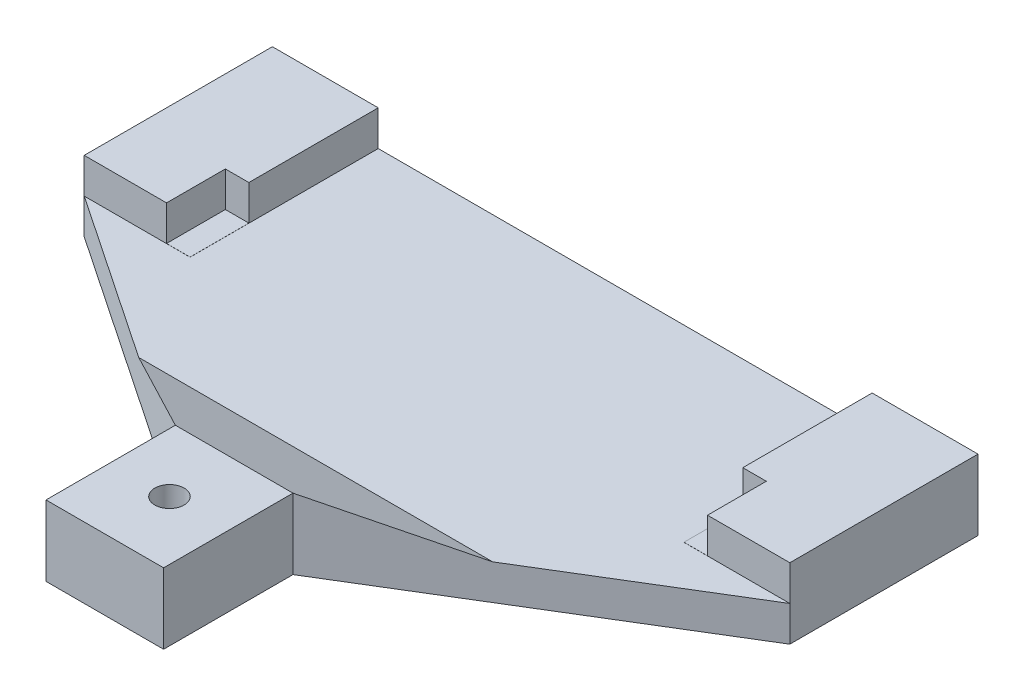
from build123d import *

# Parameters (mm, degrees)
ESQUISSE1_W              = 60
ESQUISSE1_H              = 6
BOSS_EXTRU_1_DEPTH       = 60
ESQUISSE2_R              = 1.25
ENL_V_MAT_EXTRU_1_DEPTH  = 10
ESQUISSE3_R              = 1.25
ENL_V_MAT_EXTRU_2_DEPTH  = 15
ESQUISSE4_W              = 10
ESQUISSE4_H              = 11
ENL_V_MAT_EXTRU_3_DEPTH  = 3
ENL_V_MAT_EXTRU_4_DEPTH  = 52
CHANFREIN1_SIZE2         = 6.433520762
CHANFREIN1_SIZE          = 3
ESQUISSE6_W              = 2
ESQUISSE6_H              = 5
ENL_V_MAT_EXTRU_16_DEPTH = 2.99


with BuildPart() as part:
    # Esquisse1 → Boss.-Extru.1 (new body)
    with BuildSketch(Plane.XY):
        with Locations((30, 3)):
            Rectangle(ESQUISSE1_W, ESQUISSE1_H)
    extrude(amount=BOSS_EXTRU_1_DEPTH)

    # Esquisse2 → Enlèv. mat.-Extru.1 (cut)
    with BuildSketch(Plane(origin=(0, 0, 0), x_dir=(-1, 0, 0), z_dir=(0, 0, -1))):
        with Locations((-54, 3)):
            Circle(ESQUISSE2_R)
        with Locations((-5.75, 3)):
            Circle(ESQUISSE2_R)
    extrude(amount=-ENL_V_MAT_EXTRU_1_DEPTH, mode=Mode.SUBTRACT)

    # Esquisse3 → Enlèv. mat.-Extru.2 (cut)
    with BuildSketch(Plane(origin=(0, 6, 0), x_dir=(1, 0, 0), z_dir=(0, 1, 0))):
        with Locations(Location((28.75, -37.5, 0), (0, 0, 270))):
            Circle(ESQUISSE3_R)
    extrude(amount=-ENL_V_MAT_EXTRU_2_DEPTH, mode=Mode.SUBTRACT)

    # Esquisse4 → Enlèv. mat.-Extru.3 (cut)
    with BuildSketch(Plane(origin=(0, 6, 0), x_dir=(1, 0, 0), z_dir=(0, 1, 0))):
        Polygon((0, -16), (9, -16), (9, 0), (51, 0), (51, -16), (60, -16), (60, -60), (0, -60), align=None)
        with Locations((28.75, -37.5)):
            Rectangle(ESQUISSE4_W, ESQUISSE4_H, mode=Mode.SUBTRACT)
    extrude(amount=-ENL_V_MAT_EXTRU_3_DEPTH, mode=Mode.SUBTRACT)

    # Esquisse5 → Enlèv. mat.-Extru.4 (cut)
    with BuildSketch(Plane(origin=(0, 3, 0), x_dir=(1, 0, 0), z_dir=(0, 1, 0))):
        Polygon((60, -16), (33.75, -32), (33.75, -43), (23.75, -43), (23.75, -32), (0, -16), (-21.594855386, -85.475485762), (75.414479662, -69.930764824), align=None)
    extrude(amount=-ENL_V_MAT_EXTRU_4_DEPTH, mode=Mode.SUBTRACT)

    # Chanfrein1
    chanfrein1_edges = [part.edges().sort_by_distance(p)[0] for p in [
        (28.75, 3, 32),
    ]]
    chanfrein1_side = [part.faces().sort_by_distance(p)[0] for p in [
        (28.75, 3.06, 32),
    ]]
    chamfer(chanfrein1_edges, length=CHANFREIN1_SIZE - 0.0001, length2=CHANFREIN1_SIZE2 - 0.0001, reference=chanfrein1_side[0])  # a hair under: the kernel refuses the full size

    # Esquisse6 → Enlèv. mat.-Extru.16 (cut)
    with BuildSketch(Plane(origin=(0, 6, 0), x_dir=(1, 0, 0), z_dir=(0, 1, 0))):
        with Locations((52, -13.5)):
            Rectangle(ESQUISSE6_W, ESQUISSE6_H)
        with Locations((8, -13.5)):
            Rectangle(ESQUISSE6_W, ESQUISSE6_H)
    extrude(amount=-ENL_V_MAT_EXTRU_16_DEPTH, mode=Mode.SUBTRACT)


solid = part.part
